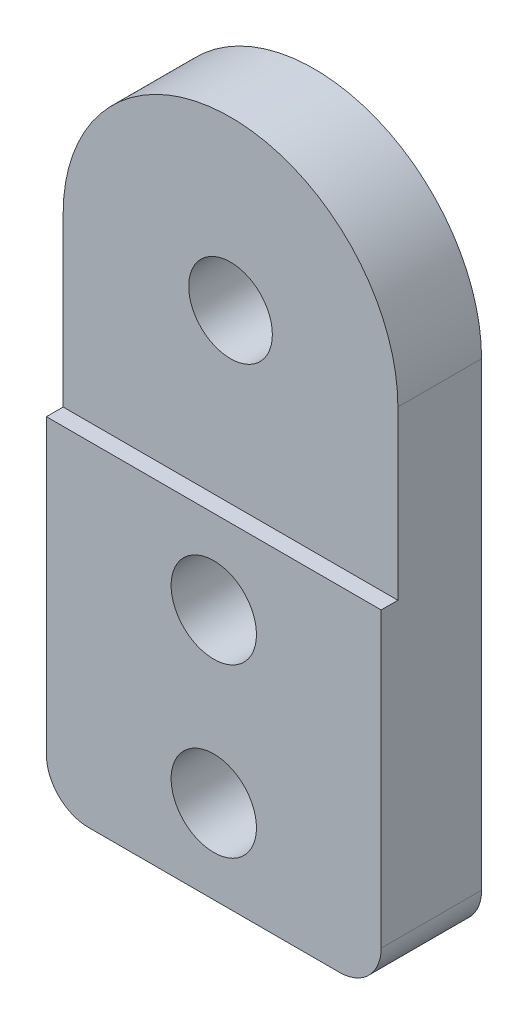
from build123d import *

# Parameters (mm, degrees)
SKETCH1_R           = 2.55
BOSS_EXTRUDE1_DEPTH = 6
SKETCH2_R           = 2.5
CUT_EXTRUDE1_DEPTH  = 33.186953879
SKETCH3_W           = 40
SKETCH3_H           = 20
CUT_EXTRUDE2_DEPTH  = 1
FILLET1_R           = 2.5


with BuildPart() as part:
    # Sketch1 → Boss-Extrude1 (new body)
    with BuildSketch(Plane.XY):
        with BuildLine():
            Line((-10, 0), (-10, -30))
            Line((-10, -30), (10, -30))
            Line((10, -30), (10, 0))
            ThreePointArc((10, 0), (0, 10), (-10, 0))
        make_face()
        with Locations((0, -25)):
            Circle(SKETCH1_R, mode=Mode.SUBTRACT)
        with Locations((0, -15)):
            Circle(SKETCH1_R, mode=Mode.SUBTRACT)
    extrude(amount=BOSS_EXTRUDE1_DEPTH)

    # Sketch2 → Cut-Extrude1 (cut, through all)
    with BuildSketch(Plane.XY.offset(6)):
        Circle(SKETCH2_R)
    extrude(amount=-CUT_EXTRUDE1_DEPTH, mode=Mode.SUBTRACT)

    # Sketch3 → Cut-Extrude2 (cut)
    with BuildSketch(Plane.XY.offset(6)):
        Rectangle(SKETCH3_W, SKETCH3_H)
    extrude(amount=-CUT_EXTRUDE2_DEPTH, mode=Mode.SUBTRACT)

    # Fillet1
    fillet1_edges = [part.edges().sort_by_distance(p)[0] for p in [
        (10, -30, 3),
        (-10, -30, 3),
    ]]
    fillet(fillet1_edges, radius=FILLET1_R)


solid = part.part
